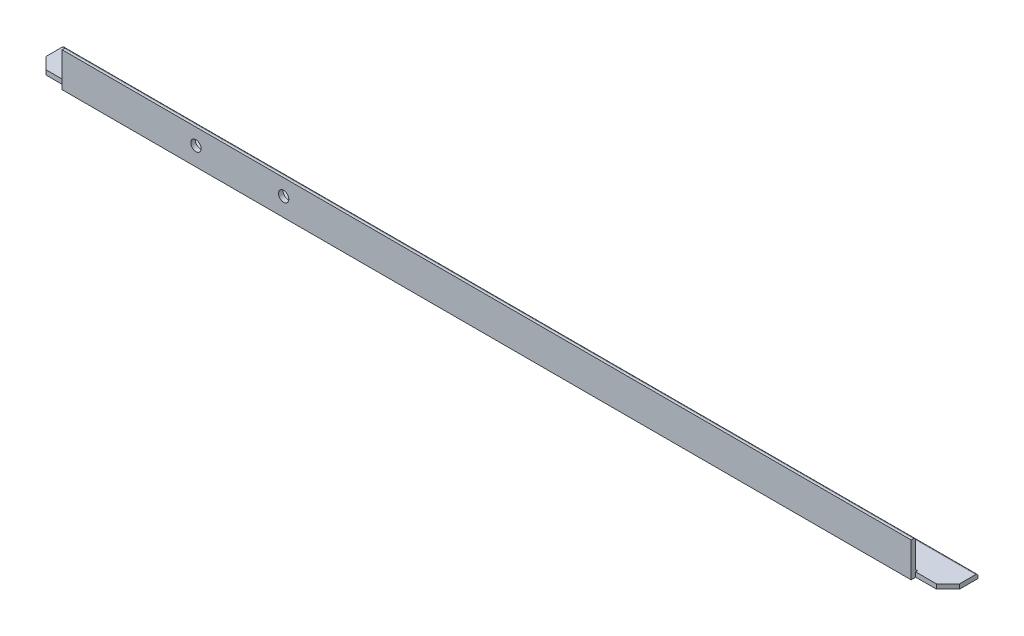
from build123d import *

# Parameters (mm, degrees)
EXTRUDE_1_DEPTH     = 396
SKETCH_4_R          = 2.25
CUT_EXTRUDE_3_DEPTH = 2
CHAMFER_1_SIZE      = 2.05
CUT_EXTRUDE_5_DEPTH = 14
CUT_EXTRUDE_6_DEPTH = 14
CUT_EXTRUDE_7_DEPTH = 397.497162663
SKETCH_10_R         = 2.25
CUT_EXTRUDE_8_DEPTH = 397.497162663


with BuildPart() as part:
    # Эскиз1 → Бобышка-Вытянуть1 (new body)
    with BuildSketch(Plane(origin=(0, 0, 0), x_dir=(0, 0, -1), z_dir=(1, 0, 0))):
        with BuildLine():
            Line((0, 0), (0, 15))
            Line((0, 15), (1, 15))
            ThreePointArc((1, 15), (1.707106781, 14.707106781), (2, 14))
            Line((2, 14), (2, 3))
            ThreePointArc((2, 3), (2.292893219, 2.292893219), (3, 2))
            Line((3, 2), (14, 2))
            ThreePointArc((14, 2), (14.707106781, 1.707106781), (15, 1))
            Line((15, 1), (15, 0))
            Line((15, 0), (0, 0))
        make_face()
    extrude(amount=EXTRUDE_1_DEPTH)

    # Эскиз4 → Вырез-Вытянуть3 (cut)
    with BuildSketch(Plane.XZ):
        with Locations(Location((371, -8, 0), (0, 0, 270))):
            Circle(SKETCH_4_R)
        with Locations(Location((198, -8, 0), (0, 0, 270))):
            Circle(SKETCH_4_R)
        with Locations(Location((25, -8, 0), (0, 0, 270))):
            Circle(SKETCH_4_R)
    extrude(amount=-CUT_EXTRUDE_3_DEPTH, mode=Mode.SUBTRACT)

    # Фаска1
    # the kernel refuses this chamfer: 2.05 mm, written as the material it takes off along each edge
    with BuildSketch(Plane(origin=(25, 0, -8), x_dir=(0, 0, -1), z_dir=(-1, 0, 0))) as chamfer_1_piece_1:
        Polygon((2.25 + CHAMFER_1_SIZE, 0), (2.25, -CHAMFER_1_SIZE), (2.25, 0), align=None)
    revolve(axis=Axis((25, 0, -8), (0, -1, 0)), mode=Mode.SUBTRACT)
    with BuildSketch(Plane(origin=(371, 0, -8), x_dir=(0, 0, -1), z_dir=(-1, 0, 0))) as chamfer_1_piece_2:
        Polygon((2.25 + CHAMFER_1_SIZE, 0), (2.25, -CHAMFER_1_SIZE), (2.25, 0), align=None)
    revolve(axis=Axis((371, 0, -8), (0, -1, 0)), mode=Mode.SUBTRACT)
    with BuildSketch(Plane(origin=(198, 0, -8), x_dir=(0, 0, -1), z_dir=(-1, 0, 0))) as chamfer_1_piece_3:
        Polygon((2.25 + CHAMFER_1_SIZE, 0), (2.25, -CHAMFER_1_SIZE), (2.25, 0), align=None)
    revolve(axis=Axis((198, 0, -8), (0, -1, 0)), mode=Mode.SUBTRACT)

    # Эскиз6 → Вырез-Вытянуть5 (cut)
    with BuildSketch(Plane(origin=(396, 0, 0), x_dir=(0, 0, -1), z_dir=(1, 0, 0))):
        Polygon((0, 15), (2, 15), (3, 15), (3, 2), (2, 2), (2, 0), (0, 0), align=None)
    extrude(amount=-CUT_EXTRUDE_5_DEPTH, mode=Mode.SUBTRACT)

    # Эскиз7 → Вырез-Вытянуть6 (cut)
    with BuildSketch(Plane.ZY):
        Polygon((0, 15), (-2, 15), (-3, 15), (-3, 2), (-2, 2), (-2, 0), (0, 0), align=None)
    extrude(amount=-CUT_EXTRUDE_6_DEPTH, mode=Mode.SUBTRACT)

    # Эскиз9 → Вырез-Вытянуть7 (cut, through all)
    with BuildSketch(Plane(origin=(0, 2, 0), x_dir=(1, 0, 0), z_dir=(0, 1, 0))):
        Polygon((0, 2), (0, 7), (5, 2), align=None)
        Polygon((396, 2), (396, 7), (391, 2), align=None)
    extrude(amount=-CUT_EXTRUDE_7_DEPTH, mode=Mode.SUBTRACT)

    # Эскиз10 → Вырез-Вытянуть8 (cut, through all)
    with BuildSketch(Plane(origin=(0, 0, -2), x_dir=(-1, 0, 0), z_dir=(0, 0, -1))):
        with Locations(Location((-72, 8, 0), (0, 0, 90))):
            Circle(SKETCH_10_R)
        with Locations(Location((-110, 8, 0), (0, 0, 90))):
            Circle(SKETCH_10_R)
    extrude(amount=-CUT_EXTRUDE_8_DEPTH, mode=Mode.SUBTRACT)


solid = part.part
